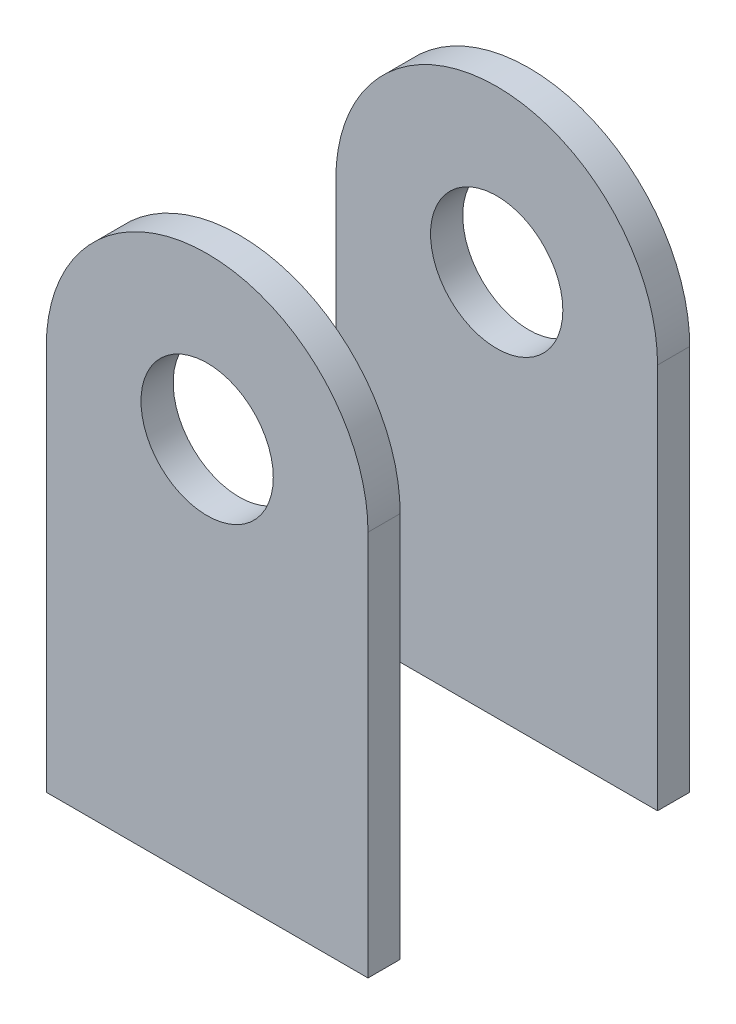
from build123d import *

# Parameters (mm, degrees)
BOSS_EXTRUDE1_START = 6.35
SKETCH1_R           = 3.2639
BOSS_EXTRUDE1_DEPTH = 1.5875
BOSS_EXTRUDE2_START = -6.35
SKETCH1_4_R         = 3.2639
BOSS_EXTRUDE2_DEPTH = 1.5875


with BuildPart() as part:
    # Sketch1 → Boss-Extrude1 (new body)
    with BuildSketch(Plane.XY.offset(BOSS_EXTRUDE1_START)):
        with BuildLine():
            ThreePointArc((7.9375, 0), (0, 7.9375), (-7.9375, 0))
            Line((-7.9375, 0), (-7.9375, -19.05))
            Line((-7.9375, -19.05), (7.9375, -19.05))
            Line((7.9375, -19.05), (7.9375, 0))
        make_face()
        Circle(SKETCH1_R, mode=Mode.SUBTRACT)
    extrude(amount=BOSS_EXTRUDE1_DEPTH)


with BuildPart() as body_2:
    # Sketch1<4> → Boss-Extrude2 (new body)
    with BuildSketch(Plane.XY.offset(BOSS_EXTRUDE2_START)):
        with BuildLine():
            ThreePointArc((7.9375, 0), (0, 7.9375), (-7.9375, 0))
            Line((-7.9375, 0), (-7.9375, -19.05))
            Line((-7.9375, -19.05), (7.9375, -19.05))
            Line((7.9375, -19.05), (7.9375, 0))
        make_face()
        Circle(SKETCH1_4_R, mode=Mode.SUBTRACT)
    extrude(amount=-BOSS_EXTRUDE2_DEPTH)


solid = Compound([part.part, body_2.part])
